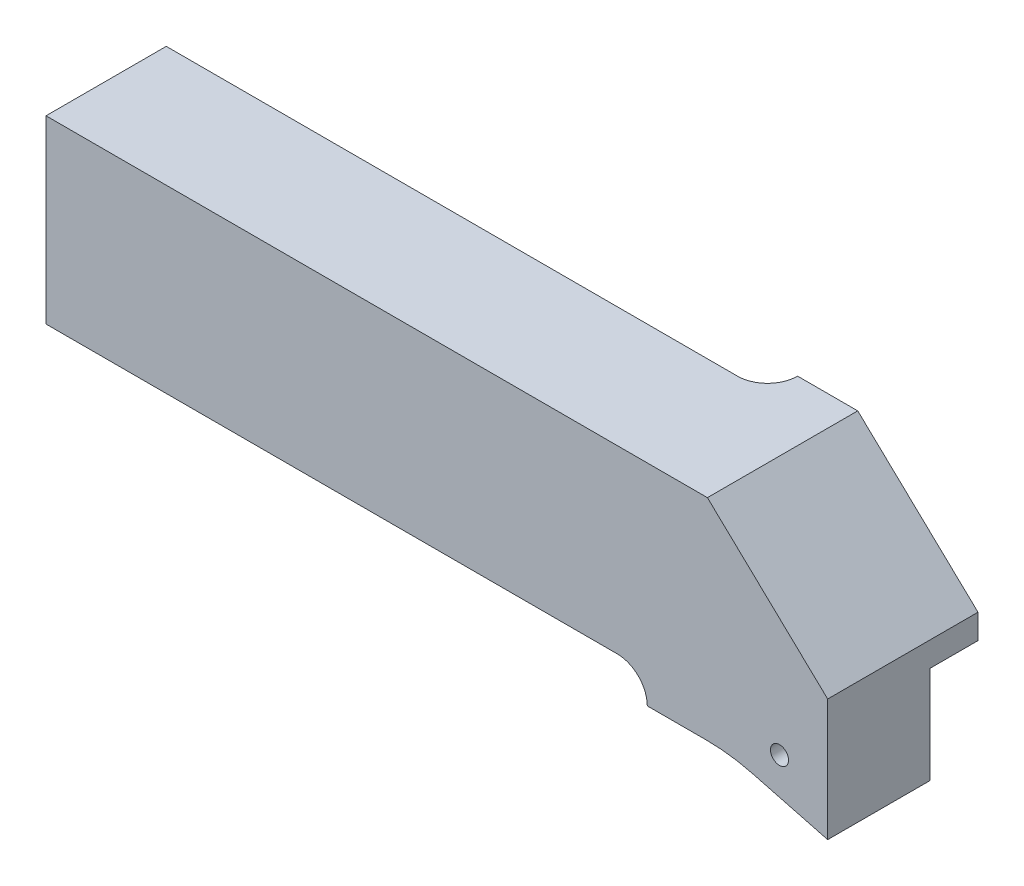
from build123d import *

# Parameters (mm, degrees)
SKETCH_1_W          = 100
SKETCH_1_H          = 30
EXTRUDE_1_DEPTH     = 20
EXTRUDE_2_DEPTH     = 25
FILLET_2_R          = 5
CUT_EXTRUDE_START   = -8
CUT_EXTRUDE_1_DEPTH = 8
SKETCH_5_R          = 1.5
CUT_EXTRUDE_2_DEPTH = 95.750127505


with BuildPart() as part:
    # 草图1 → 凸台-拉伸1 (new body)
    with BuildSketch(Plane.XY):
        with Locations((10, 0)):
            Rectangle(SKETCH_1_W, SKETCH_1_H)
    extrude(amount=EXTRUDE_1_DEPTH)

    # 草图2 → 凸台-拉伸2 (add)
    with BuildSketch(Plane.XY.offset(20)):
        with BuildLine():
            Line((60, 15), (70, 15))
            Line((70, 15), (90, -4))
            Line((90, -4), (90, -20))
            Line((90, -20), (90, -24.260805059))
            Line((90, -24.260805059), (77.430397402, -20.975197102))
            ThreePointArc((77.430397402, -20.975197102), (73.668164046, -20.244798043), (69.843512882, -20))
            Line((69.843512882, -20), (60, -20))
            Line((60, -20), (60, 15))
        make_face()
    extrude(amount=-EXTRUDE_2_DEPTH)

    # 圆角2
    fillet_2_edges = [part.edges().sort_by_distance(p)[0] for p in [
        (60, -15, 10),
        (60, 0, 0),
    ]]
    fillet(fillet_2_edges, radius=FILLET_2_R - 0.0001)  # a hair under: the kernel refuses the full size

    # 草图4 → 切除-拉伸1 (cut)
    with BuildSketch(Plane(origin=(0, 0, -5), x_dir=(-1, 0, 0), z_dir=(0, 0, -1)).offset(CUT_EXTRUDE_START)):
        with BuildLine():
            Line((-90, -8.096027328), (-75, -8.928770232))
            Line((-75, -8.928770232), (-75, -20.446478372))
            ThreePointArc((-75, -20.446478372), (-76.220680439, -20.685639459), (-77.430397402, -20.975197102))
            Line((-77.430397402, -20.975197102), (-90, -24.260805059))
            Line((-90, -24.260805059), (-90, -8.096027328))
        make_face()
    extrude(amount=CUT_EXTRUDE_1_DEPTH, mode=Mode.SUBTRACT)

    # 草图5 → 切除-拉伸2 (cut, through all)
    with BuildSketch(Plane(origin=(0, 0, 3), x_dir=(-1, 0, 0), z_dir=(0, 0, -1))):
        with Locations((-81.993244167, -16.076814441)):
            Circle(SKETCH_5_R)
    extrude(amount=-CUT_EXTRUDE_2_DEPTH, mode=Mode.SUBTRACT)


solid = part.part
